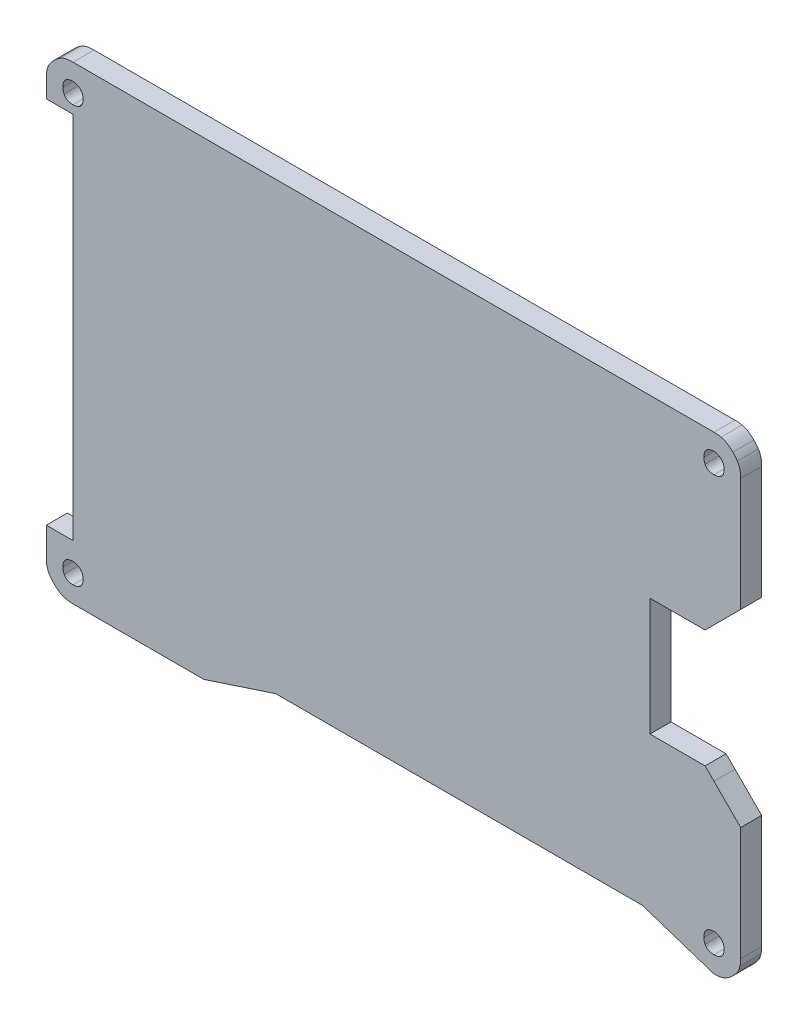
from build123d import *

# Parameters (mm, degrees)
BOSS_EXTRUDE2_DEPTH = 2.9972
BOSS_EXTRUDE3_DEPTH = 2.9972


# Read off the part's stored shape, not the designer's step: Boss-Extrude2
with BuildPart() as part:
    # Boss-Extrude2 outline → Boss-Extrude2 (new body)
    with BuildSketch(Plane.XY):
        with BuildLine():
            Line((-305.439439951, 322.333011906), (-313.30953996, 322.333011897))
            Line((-313.30953996, 322.333011897), (-313.30953996, 339.125611897))
            Line((-313.30953996, 339.125611897), (-305.43943996, 339.125611897))
            Line((-305.43943996, 339.125611897), (-300.35943996, 344.205611897))
            Line((-300.35943996, 344.205611897), (-300.35943996, 360.398811897))
            add(Edge.make_bspline(
                [(-300.84003996, 362.316836897), (-300.560989959508, 361.895161896674), (-300.360139959508, 361.408611896674), (-300.35943996, 360.398811897)],
                knots=[0.583333333333333, 0.583333333333333, 0.583333333333333, 0.583333333333333, 0.611111111111111, 0.611111111111111, 0.611111111111111, 0.611111111111111], degree=3))
            add(Edge.make_bspline(
                [(-301.47633996, 363.095311897), (-301.119089959508, 362.738511896674), (-300.84003996, 362.316836897)],
                knots=[0.555555555555556, 0.555555555555556, 0.555555555555556, 0.583333333333333, 0.583333333333333, 0.583333333333333], degree=2))
            add(Edge.make_bspline(
                [(-303.16983996, 364.109161897), (-302.675239959508, 364.009161896674), (-302.190939959508, 363.808911896674), (-301.47633996, 363.095311897)],
                knots=[0.472222222222222, 0.472222222222222, 0.472222222222222, 0.472222222222222, 0.5, 0.5, 0.5, 0.5], degree=3))
            add(Edge.make_bspline(
                [(-304.16933996, 364.208911897), (-303.664439959508, 364.209161896674), (-303.16983996, 364.109161897)],
                knots=[0.444444444444444, 0.444444444444444, 0.444444444444444, 0.472222222222222, 0.472222222222222, 0.472222222222222], degree=2))
            add(Edge.make_bspline(
                [(-304.16933996, 364.208911897), (-304.169389959507, 364.208861896674), (-304.16933996, 364.208911897)],
                knots=[0.416666666666667, 0.416666666666667, 0.416666666666667, 0.444444444444444, 0.444444444444444, 0.444444444444444], degree=2))
            Line((-304.16933996, 364.208911897), (-395.65933996, 364.208811897))
            add(Edge.make_bspline(
                [(-397.57728996, 363.728286897), (-397.155639959508, 364.007311896674), (-396.669139959508, 364.208111896674), (-395.65933996, 364.208811897)],
                knots=[0.25, 0.25, 0.25, 0.25, 0.277777777777778, 0.277777777777778, 0.277777777777778, 0.277777777777778], degree=3))
            add(Edge.make_bspline(
                [(-398.35573996, 363.092011897), (-397.998939959508, 363.449261896674), (-397.57728996, 363.728286897)],
                knots=[0.222222222222222, 0.222222222222222, 0.222222222222222, 0.25, 0.25, 0.25], degree=2))
            add(Edge.make_bspline(
                [(-399.36961496, 361.398411897), (-399.269639959508, 361.893011896674), (-399.069439959508, 362.377311896674), (-398.35573996, 363.092011897)],
                knots=[0.138888888888889, 0.138888888888889, 0.138888888888889, 0.138888888888889, 0.166666666666667, 0.166666666666667, 0.166666666666667, 0.166666666666667], degree=3))
            add(Edge.make_bspline(
                [(-399.46933996, 360.398911897), (-399.469589959508, 360.903811896674), (-399.36961496, 361.398411897)],
                knots=[0.111111111111111, 0.111111111111111, 0.111111111111111, 0.138888888888889, 0.138888888888889, 0.138888888888889], degree=2))
            Line((-399.46933996, 360.398911897), (-399.46933996, 357.769311897))
            Line((-399.46933996, 357.769311897), (-395.65933996, 357.769311897))
            Line((-395.65933996, 357.769311897), (-395.65933996, 305.073111897))
            Line((-395.65933996, 305.073111897), (-399.46933996, 305.073111897))
            Line((-399.46933996, 305.073111897), (-399.46933996, 301.059911897))
            add(Edge.make_bspline(
                [(-398.98876496, 299.141936897), (-399.267839959508, 299.563561896674), (-399.468739959508, 300.050011896674), (-399.46933996, 301.059911897)],
                knots=[0.5625, 0.5625, 0.5625, 0.5625, 0.625, 0.625, 0.625, 0.625], degree=3))
            add(Edge.make_bspline(
                [(-398.35243996, 298.363511897), (-398.709689959508, 298.720311896674), (-398.98876496, 299.141936897)],
                knots=[0.5, 0.5, 0.5, 0.5625, 0.5625, 0.5625], degree=2))
            add(Edge.make_bspline(
                [(-396.65888996, 297.349586897), (-397.153539959508, 297.449561896674), (-397.637939959508, 297.649811896674), (-398.35243996, 298.363511897)],
                knots=[0.3125, 0.3125, 0.3125, 0.3125, 0.375, 0.375, 0.375, 0.375], degree=3))
            add(Edge.make_bspline(
                [(-395.65933996, 297.249911897), (-396.164239959508, 297.249611896674), (-396.65888996, 297.349586897)],
                knots=[0.25, 0.25, 0.25, 0.3125, 0.3125, 0.3125], degree=2))
            Line((-395.65933996, 297.249911897), (-376.96873996, 297.249911897))
            Line((-376.96873996, 297.249911897), (-366.72863996, 300.616411897))
            Line((-366.72863996, 300.616411897), (-314.40943996, 300.616411897))
            Line((-314.40943996, 300.616411897), (-304.16943996, 297.249911897))
            add(Edge.make_bspline(
                [(-302.25148996, 297.730486897), (-302.673139959508, 297.451411896674), (-303.159639959508, 297.250511896674), (-304.16943996, 297.249911897)],
                knots=[0.9, 0.9, 0.9, 0.9, 1, 1, 1, 1], degree=3))
            add(Edge.make_bspline(
                [(-301.47303996, 298.366811897), (-301.829839959508, 298.009561896674), (-302.25148996, 297.730486897)],
                knots=[0.8, 0.8, 0.8, 0.9, 0.9, 0.9], degree=2))
            add(Edge.make_bspline(
                [(-300.45913996, 300.060311897), (-300.559139959508, 299.565661896674), (-300.759439959508, 299.081311896674), (-301.47303996, 298.366811897)],
                knots=[0.65, 0.65, 0.65, 0.65, 0.7, 0.7, 0.7, 0.7], degree=3))
            add(Edge.make_bspline(
                [(-300.35943996, 301.059911897), (-300.359139959508, 300.554961896674), (-300.45913996, 300.060311897)],
                knots=[0.6, 0.6, 0.6, 0.65, 0.65, 0.65], degree=2))
            Line((-300.35943996, 301.059911897), (-300.35943996, 317.253011897))
            add(Edge.make_bspline(
                [(-304.16938996, 321.063011897), (-302.899389959508, 319.793011896674), (-300.35943996, 317.253011897)],
                knots=[0.25, 0.25, 0.25, 0.3, 0.3, 0.3], degree=2))
            add(Edge.make_bspline(
                [(-305.439439951, 322.333011906), (-305.4394398553593, 322.3330118190078), (-305.439439759272, 322.333011732398), (-305.438933198386, 322.332555135552), (-304.16938996, 321.063011897)],
                knots=[0.20000850185556637, 0.20000850185556637, 0.20000850185556637, 0.200017982721329, 0.200017982721329, 0.25, 0.25, 0.25], degree=2))
        make_face()
        with BuildLine():
            add(Edge.make_bspline(
                [(-394.89751496, 299.774136897), (-394.535589959508, 299.936161896674), (-394.211539959508, 300.260211896674), (-394.21153996, 301.059811897)],
                knots=[0.875, 0.875, 0.875, 0.875, 1, 1, 1, 1], degree=3))
            add(Edge.make_bspline(
                [(-395.65923996, 299.612111897), (-395.259439959508, 299.612111896674), (-394.89751496, 299.774136897)],
                knots=[0.75, 0.75, 0.75, 0.875, 0.875, 0.875], degree=2))
            add(Edge.make_bspline(
                [(-396.94503996, 300.298161897), (-396.782989959508, 299.936211896674), (-396.458939959508, 299.612111896674), (-395.65923996, 299.612111897)],
                knots=[0.5625, 0.5625, 0.5625, 0.5625, 0.625, 0.625, 0.625, 0.625], degree=3))
            add(Edge.make_bspline(
                [(-397.10713996, 301.059911897), (-397.107089959508, 300.660111896674), (-396.94503996, 300.298161897)],
                knots=[0.5, 0.5, 0.5, 0.5625, 0.5625, 0.5625], degree=2))
            add(Edge.make_bspline(
                [(-396.42108996, 302.345661897), (-396.783039959508, 302.183611896674), (-397.107139959508, 301.859511896674), (-397.10713996, 301.059911897)],
                knots=[0.3125, 0.3125, 0.3125, 0.3125, 0.375, 0.375, 0.375, 0.375], degree=3))
            add(Edge.make_bspline(
                [(-395.65933996, 302.507711897), (-396.059139959508, 302.507711896674), (-396.42108996, 302.345661897)],
                knots=[0.25, 0.25, 0.25, 0.3125, 0.3125, 0.3125], degree=2))
            add(Edge.make_bspline(
                [(-394.21153996, 301.059811897), (-394.211539959508, 301.859411896674), (-394.859739959508, 302.507711896674), (-395.65933996, 302.507711897)],
                knots=[0, 0, 0, 0, 0.125, 0.125, 0.125, 0.125], degree=3))
        make_face(mode=Mode.SUBTRACT)
        with BuildLine():
            add(Edge.make_bspline(
                [(-303.40771496, 299.774136897), (-303.045789959508, 299.936161896674), (-302.721739959508, 300.260211896674), (-302.72163996, 301.059811897)],
                knots=[0.875, 0.875, 0.875, 0.875, 1, 1, 1, 1], degree=3))
            add(Edge.make_bspline(
                [(-304.16943996, 299.612111897), (-303.769639959508, 299.612111896674), (-303.40771496, 299.774136897)],
                knots=[0.75, 0.75, 0.75, 0.875, 0.875, 0.875], degree=2))
            add(Edge.make_bspline(
                [(-305.45521496, 300.298161897), (-305.293189959508, 299.936211896674), (-304.969139959508, 299.612111896674), (-304.16943996, 299.612111897)],
                knots=[0.5625, 0.5625, 0.5625, 0.5625, 0.625, 0.625, 0.625, 0.625], degree=3))
            add(Edge.make_bspline(
                [(-305.61723996, 301.059911897), (-305.617239959508, 300.660111896674), (-305.45521496, 300.298161897)],
                knots=[0.5, 0.5, 0.5, 0.5625, 0.5625, 0.5625], degree=2))
            add(Edge.make_bspline(
                [(-304.93118996, 302.345661897), (-305.293139959508, 302.183611896674), (-305.617239959508, 301.859511896674), (-305.61723996, 301.059911897)],
                knots=[0.3125, 0.3125, 0.3125, 0.3125, 0.375, 0.375, 0.375, 0.375], degree=3))
            add(Edge.make_bspline(
                [(-304.16943996, 302.507711897), (-304.569239959508, 302.507711896674), (-304.93118996, 302.345661897)],
                knots=[0.25, 0.25, 0.25, 0.3125, 0.3125, 0.3125], degree=2))
            add(Edge.make_bspline(
                [(-302.72163996, 301.059811897), (-302.721639959508, 301.859411896674), (-303.369839959508, 302.507711896674), (-304.16943996, 302.507711897)],
                knots=[0, 0, 0, 0, 0.125, 0.125, 0.125, 0.125], degree=3))
        make_face(mode=Mode.SUBTRACT)
        Polygon((-310.76953996, 315.519718407), (-310.76953996, 305.073111897), (-390.65553996, 305.073111897), (-390.65553996, 357.769311897), (-310.76953996, 357.769311897), (-310.76953996, 345.938905386), (-320.60223996, 345.938905386), (-320.60223996, 315.519718407), align=None, mode=Mode.SUBTRACT)
        with BuildLine():
            add(Edge.make_bspline(
                [(-394.89751496, 359.113111897), (-394.535589959508, 359.275161896674), (-394.211539959508, 359.599211896674), (-394.21153996, 360.398811897)],
                knots=[0.875, 0.875, 0.875, 0.875, 1, 1, 1, 1], degree=3))
            add(Edge.make_bspline(
                [(-395.65923996, 358.951011897), (-395.259439959508, 358.951061896674), (-394.89751496, 359.113111897)],
                knots=[0.75, 0.75, 0.75, 0.875, 0.875, 0.875], degree=2))
            add(Edge.make_bspline(
                [(-396.94503996, 359.637061897), (-396.782989959508, 359.275111896674), (-396.458939959508, 358.951011896674), (-395.65923996, 358.951011897)],
                knots=[0.5625, 0.5625, 0.5625, 0.5625, 0.625, 0.625, 0.625, 0.625], degree=3))
            add(Edge.make_bspline(
                [(-397.10713996, 360.398811897), (-397.107089959508, 359.999011896674), (-396.94503996, 359.637061897)],
                knots=[0.5, 0.5, 0.5, 0.5625, 0.5625, 0.5625], degree=2))
            add(Edge.make_bspline(
                [(-396.42108996, 361.684561897), (-396.783039959508, 361.522511896674), (-397.107139959508, 361.198411896674), (-397.10713996, 360.398811897)],
                knots=[0.3125, 0.3125, 0.3125, 0.3125, 0.375, 0.375, 0.375, 0.375], degree=3))
            add(Edge.make_bspline(
                [(-395.65933996, 361.846611897), (-396.059139959508, 361.846611896674), (-396.42108996, 361.684561897)],
                knots=[0.25, 0.25, 0.25, 0.3125, 0.3125, 0.3125], degree=2))
            add(Edge.make_bspline(
                [(-394.21153996, 360.398811897), (-394.211539959508, 361.198411896674), (-394.859739959508, 361.846611896674), (-395.65933996, 361.846611897)],
                knots=[0, 0, 0, 0, 0.125, 0.125, 0.125, 0.125], degree=3))
        make_face(mode=Mode.SUBTRACT)
        with BuildLine():
            add(Edge.make_bspline(
                [(-303.40771496, 359.113111897), (-303.045789959508, 359.275161896674), (-302.721739959508, 359.599211896674), (-302.72163996, 360.398811897)],
                knots=[0.875, 0.875, 0.875, 0.875, 1, 1, 1, 1], degree=3))
            add(Edge.make_bspline(
                [(-304.16943996, 358.951011897), (-303.769639959508, 358.951061896674), (-303.40771496, 359.113111897)],
                knots=[0.75, 0.75, 0.75, 0.875, 0.875, 0.875], degree=2))
            add(Edge.make_bspline(
                [(-305.45521496, 359.637061897), (-305.293189959508, 359.275111896674), (-304.969139959508, 358.951011896674), (-304.16943996, 358.951011897)],
                knots=[0.5625, 0.5625, 0.5625, 0.5625, 0.625, 0.625, 0.625, 0.625], degree=3))
            add(Edge.make_bspline(
                [(-305.61723996, 360.398811897), (-305.617239959508, 359.999011896674), (-305.45521496, 359.637061897)],
                knots=[0.5, 0.5, 0.5, 0.5625, 0.5625, 0.5625], degree=2))
            add(Edge.make_bspline(
                [(-304.93118996, 361.684561897), (-305.293139959508, 361.522511896674), (-305.617239959508, 361.198411896674), (-305.61723996, 360.398811897)],
                knots=[0.3125, 0.3125, 0.3125, 0.3125, 0.375, 0.375, 0.375, 0.375], degree=3))
            add(Edge.make_bspline(
                [(-304.16943996, 361.846611897), (-304.569239959508, 361.846611896674), (-304.93118996, 361.684561897)],
                knots=[0.25, 0.25, 0.25, 0.3125, 0.3125, 0.3125], degree=2))
            add(Edge.make_bspline(
                [(-302.72163996, 360.398811897), (-302.721639959508, 361.198411896674), (-303.369839959508, 361.846611896674), (-304.16943996, 361.846611897)],
                knots=[0, 0, 0, 0, 0.125, 0.125, 0.125, 0.125], degree=3))
        make_face(mode=Mode.SUBTRACT)
    extrude(amount=BOSS_EXTRUDE2_DEPTH)

    # Model<4> → Boss-Extrude3 (add)
    with BuildSketch(Plane.XY):
        with BuildLine():
            add(Edge.make_bspline(
                [(-310.7695399595076, 305.0731118966739), (-321.0901046985102, 305.0731118966739), (-390.65553995950745, 305.0731118966739)],
                knots=[0.07417882674263156, 0.07417882674263156, 0.07417882674263156, 1, 1, 1], degree=2))
            add(Edge.make_bspline(
                [(-390.65553995950745, 357.7693118966738), (-390.6555399595075, 351.9052434260239), (-390.65553995950745, 305.0731118966739)],
                knots=[0.04841963954607231, 0.04841963954607231, 0.04841963954607231, 1, 1, 1], degree=2))
            add(Edge.make_bspline(
                [(-310.76953995950754, 357.7693118966738), (-373.8524059254858, 357.7693118966738), (-390.65553995950745, 357.7693118966738)],
                knots=[0, 0, 0, 0.8422245853209437, 0.8422245853209437, 0.8422245853209437], degree=2))
            add(Edge.make_bspline(
                [(-310.76953995950754, 357.7693118966738), (-310.76953995950754, 353.3667449812714), (-310.76953995950754, 345.9389053859011)],
                knots=[0, 0, 0, 0.657452787677496, 0.657452787677496, 0.657452787677496], degree=2))
            Line((-310.76953995950754, 345.9389053859011), (-320.6022399595075, 345.9389053859011))
            add(Edge.make_bspline(
                [(-320.6022399595075, 345.9389053859011), (-320.6022399595075, 336.80473222993606), (-320.6022399595075, 324.2862450388385), (-320.6022399595075, 315.51971840744665)],
                knots=[0.30670534056026655, 0.30670534056026655, 0.30670534056026655, 0.30670534056026655, 0.7142927432534247, 0.7142927432534247, 0.7142927432534247, 0.7142927432534247], degree=3))
            Line((-320.6022399595075, 315.51971840744665), (-310.76953995950754, 315.51971840744665))
            add(Edge.make_bspline(
                [(-310.76953995950754, 315.51971840744665), (-310.76953995950754, 310.75979442293607), (-310.7695399595076, 305.0731118966739)],
                knots=[0.43218739452757277, 0.43218739452757277, 0.43218739452757277, 1, 1, 1], degree=2))
        make_face()
    extrude(amount=BOSS_EXTRUDE3_DEPTH)


solid = part.part
